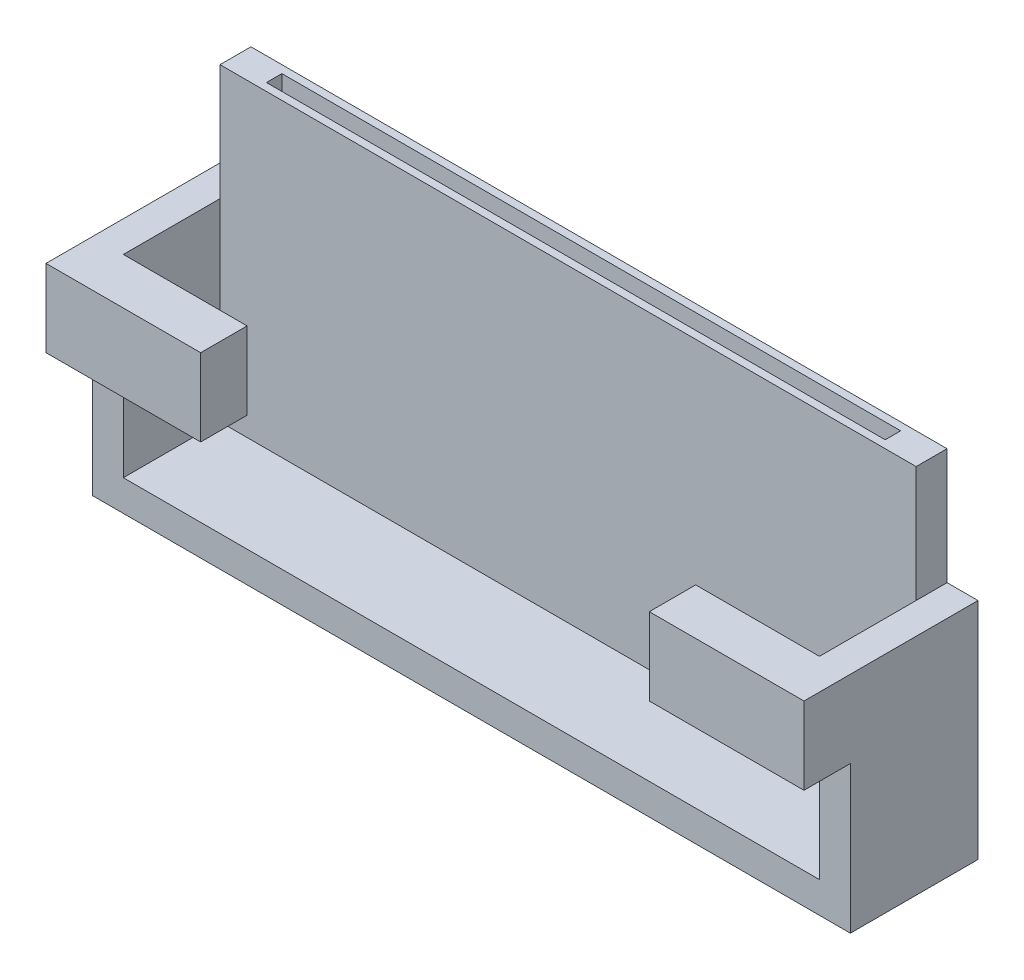
from build123d import *

# Parameters (mm, degrees)
SKETCH1_W           = 45
SKETCH1_H           = 7.5
SKETCH1_H_2         = 12.5
BOSS_EXTRUDE1_DEPTH = 2
BOSS_EXTRUDE2_DEPTH = 8.25
SKETCH3_W           = 10
SKETCH3_H           = 5
BOSS_EXTRUDE3_DEPTH = 3
SKETCH4_W           = 40
SKETCH4_H           = 1
CUT_EXTRUDE1_DEPTH  = 2
LOFT2_START         = -7.5
LOFT2_DEPTH         = 15


# Read off the part's stored shape, not the designer's step: Loft2
with BuildPart() as part:
    # Sketch1 → Boss-Extrude1 (new body)
    with BuildSketch(Plane.XY):
        with Locations((0, 6.25)):
            Rectangle(SKETCH1_W, SKETCH1_H)
        with Locations((0, -3.75)):
            Rectangle(SKETCH1_W, SKETCH1_H_2)
    extrude(amount=BOSS_EXTRUDE1_DEPTH)

    # Sketch1<3> → Boss-Extrude2 (add)
    with BuildSketch(Plane.XY):
        Polygon((-22.5, 2.5), (-24.5, 2.5), (-24.5, -12), (24.5, -12), (24.5, 2.5), (22.5, 2.5), (22.5, -10), (-22.5, -10), align=None)
    extrude(amount=BOSS_EXTRUDE2_DEPTH)

    # Sketch3 → Boss-Extrude3 (add)
    with BuildSketch(Plane.XY.offset(8.25)):
        with Locations((-19.5, 0)):
            Rectangle(SKETCH3_W, SKETCH3_H)
        with Locations((19.5, 0)):
            Rectangle(SKETCH3_W, SKETCH3_H)
    extrude(amount=BOSS_EXTRUDE3_DEPTH)

    # Sketch4 → Cut-Extrude1 (cut)
    with BuildSketch(Plane(origin=(0, 10, 0), x_dir=(1, 0, 0), z_dir=(0, 1, 0))):
        with Locations((0, -1)):
            Rectangle(SKETCH4_W, SKETCH4_H)
    extrude(amount=-CUT_EXTRUDE1_DEPTH, mode=Mode.SUBTRACT)

    # Loft2 outline → Loft2 (add)
    with BuildSketch(Plane.YZ.offset(LOFT2_START)):
        with BuildLine():
            add(Edge.make_bspline(
                [(1.5, 0), (1.5, -1.699673171), (2, -3.349836586), (2.5, -5)],
                knots=[0, 0, 0, 0, 1, 1, 1, 1], degree=3))
            Line((1.5, 0), (-1.5, 0))
            add(Edge.make_bspline(
                [(-1.5, 0), (-1.5, -1.699673171), (-2, -3.349836586), (-2.5, -5)],
                knots=[0, 0, 0, 0, 1, 1, 1, 1], degree=3))
            Line((-2.5, -5), (2.5, -5))
        make_face()
    extrude(amount=LOFT2_DEPTH)


solid = part.part
